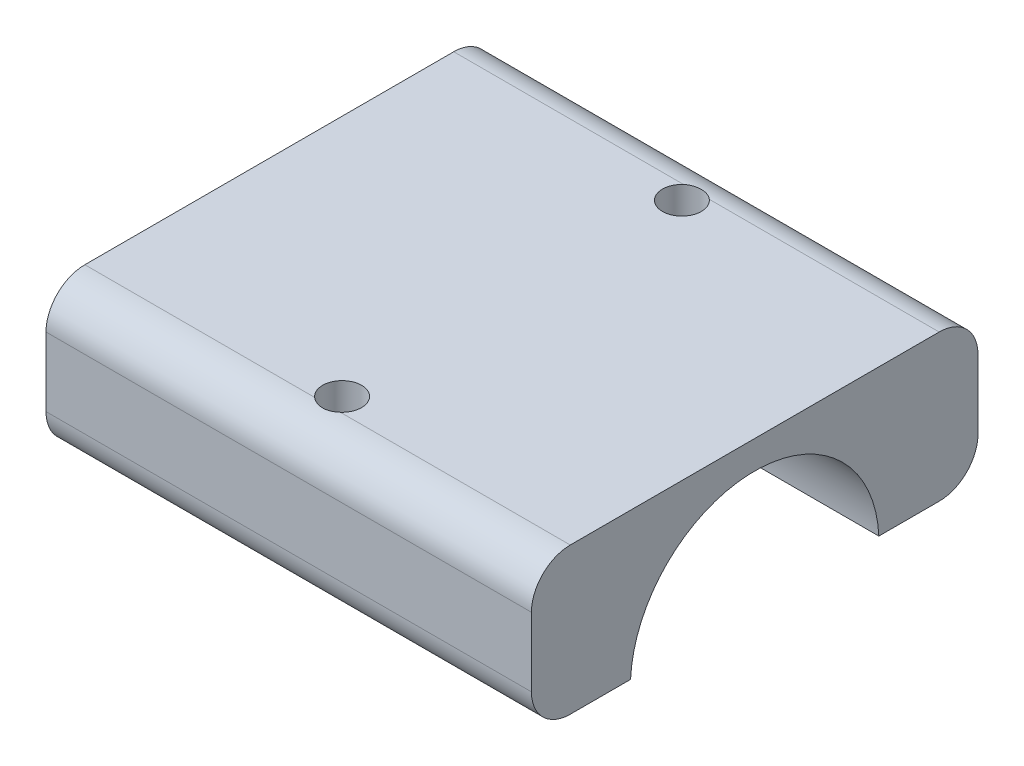
from build123d import *

# Parameters (mm, degrees)
BOSS_EXTRUDE1_DEPTH     = 25
CUT_EXTRUDE1_DEPTH      = 38.423121195
CUT_EXTRUDE1_DEPTH_BACK = 38.423121195
SKETCH2_R               = 12.8
SKETCH3_R               = 2
CUT_EXTRUDE2_DEPTH      = 7.5
SKETCH4_R               = 2
CUT_EXTRUDE3_DEPTH      = 7.5


with BuildPart() as part:
    # Sketch1 → Boss-Extrude1 (new, symmetric)
    with BuildSketch(Plane(origin=(0, 0, 0), x_dir=(0, 0, -1), z_dir=(1, 0, 0))):
        with BuildLine():
            Line((-19, 0.6), (19, 0.6))
            ThreePointArc((19, 0.6), (21.828427125, 1.771572875), (23, 4.6))
            Line((23, 4.6), (23, 11.7))
            ThreePointArc((23, 11.7), (21.828427125, 14.528427125), (19, 15.7))
            Line((19, 15.7), (-19, 15.7))
            ThreePointArc((-19, 15.7), (-21.828427125, 14.528427125), (-23, 11.7))
            Line((-23, 11.7), (-23, 4.6))
            ThreePointArc((-23, 4.6), (-21.828427125, 1.771572875), (-19, 0.6))
        make_face()
    extrude(amount=BOSS_EXTRUDE1_DEPTH, both=True)

    # Sketch2 → Cut-Extrude1 (cut, two sides: drawn at the far end of the back side and taken through both)
    with BuildSketch(Plane(origin=(0, 0, 0), x_dir=(0, 0, -1), z_dir=(1, 0, 0)).offset(-CUT_EXTRUDE1_DEPTH_BACK)):
        Circle(SKETCH2_R)
    extrude(amount=CUT_EXTRUDE1_DEPTH + CUT_EXTRUDE1_DEPTH_BACK, mode=Mode.SUBTRACT)

    # Sketch3 → Cut-Extrude2 (cut)
    with BuildSketch(Plane(origin=(0, 0.6, 0), x_dir=(1, 0, 0), z_dir=(0, 1, 0))):
        with Locations((18, -17.5)):
            Circle(SKETCH3_R)
        with Locations((18, 17.5)):
            Circle(SKETCH3_R)
        with Locations((-18, -17.5)):
            Circle(SKETCH3_R)
        with Locations((-18, 17.5)):
            Circle(SKETCH3_R)
    extrude(amount=CUT_EXTRUDE2_DEPTH, mode=Mode.SUBTRACT)

    # Sketch4 → Cut-Extrude3 (cut)
    with BuildSketch(Plane(origin=(0, 15.7, 0), x_dir=(1, 0, 0), z_dir=(0, 1, 0))):
        with Locations((0, -17.5)):
            Circle(SKETCH4_R)
        with Locations((0, 17.5)):
            Circle(SKETCH4_R)
    extrude(amount=-CUT_EXTRUDE3_DEPTH, mode=Mode.SUBTRACT)


solid = part.part
